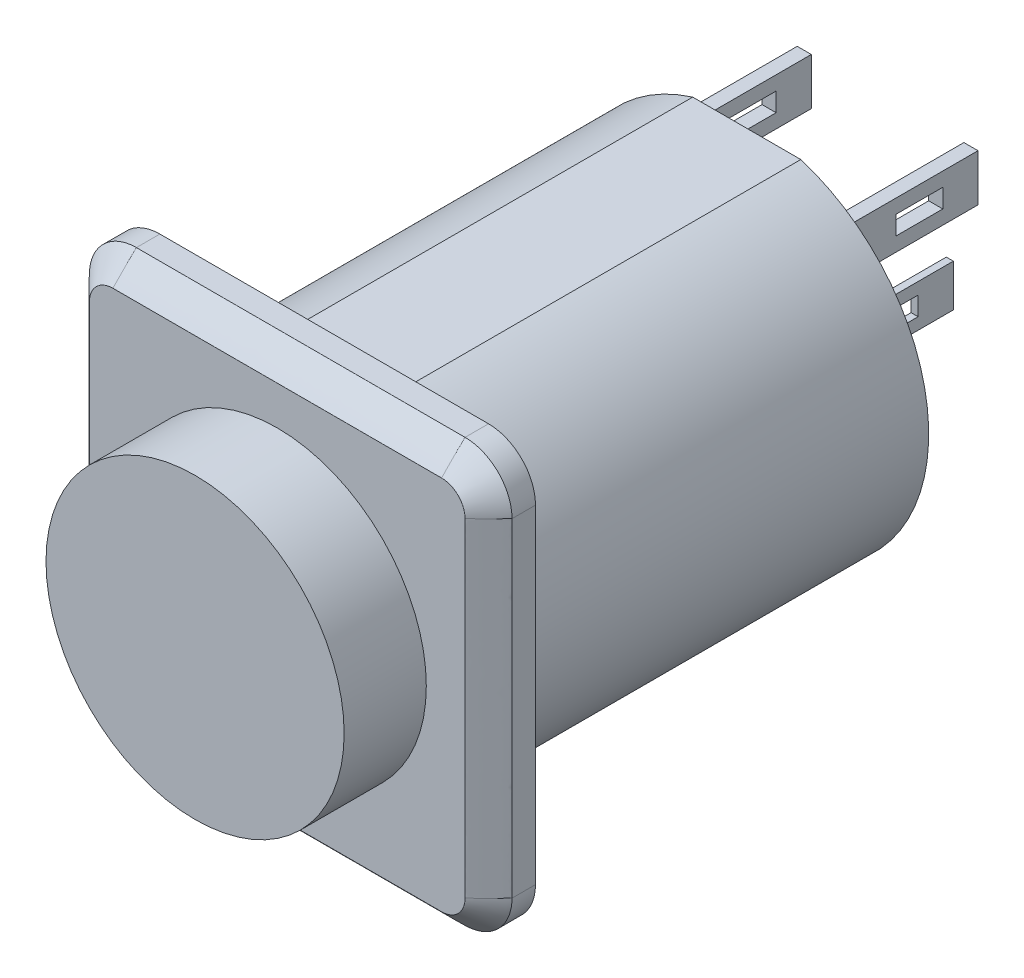
from build123d import *

# Parameters (mm, degrees)
SKETCH1_W             = 18
SKETCH1_H             = 18
BOSS_EXTRUDE1_DEPTH   = 2
FILLET1_R             = 2
FILLET2_SIZE          = 1
SKETCH2_R             = 6.35
BOSS_EXTRUDE2_DEPTH   = 3.5
BOSS_EXTRUDE3_DEPTH   = 18
SKETCH4_W             = 0.6
SKETCH4_H             = 2
BOSS_EXTRUDE4_DEPTH   = 6
SKETCH4_W_2           = 0.3
SKETCH4_H_2           = 1.8
BOSS_EXTRUDE4_2_DEPTH = 6
BOSS_EXTRUDE4_3_DEPTH = 6
BOSS_EXTRUDE4_4_DEPTH = 6
SKETCH5_W             = 2
SKETCH5_H             = 0.8
CUT_EXTRUDE1_DEPTH    = 29.672678709


with BuildPart() as part:
    # Sketch1 → Boss-Extrude1 (new body)
    with BuildSketch(Plane.XY):
        Rectangle(SKETCH1_W, SKETCH1_H)
    extrude(amount=BOSS_EXTRUDE1_DEPTH)

    # Fillet1
    fillet1_edges = [part.edges().sort_by_distance(p)[0] for p in [
        (9, -9, 1),
        (-9, -9, 1),
        (-9, 9, 1),
        (9, 9, 1),
    ]]
    fillet(fillet1_edges, radius=FILLET1_R)

    # Fillet2
    # a fillet whose section is not a circle: 1 mm, written as the material it takes off along each edge
    with BuildSketch(Plane(origin=(-7, 7, 2), x_dir=(0, 1, 0), z_dir=(1, 0, 0))) as fillet2_piece_1:
        with BuildLine():
            Bezier((2, -FILLET2_SIZE), (2, 0), (2 - FILLET2_SIZE, 0), weights=[1, 0.014142136, 1])
            Line((2 - FILLET2_SIZE, 0), (2, 0))
            Line((2, 0), (2, -FILLET2_SIZE))
        make_face()
    revolve(axis=Axis((-7, 7, 2), (0, 0, 1)), revolution_arc=90, mode=Mode.SUBTRACT)
    with BuildSketch(Plane(origin=(-7, 9, 2), x_dir=(0, 0, -1), z_dir=(1, 0, 0))) as fillet2_piece_2:
        with BuildLine():
            Bezier((FILLET2_SIZE, 0), (0, 0), (0, -FILLET2_SIZE), weights=[1, 0.014142136, 1])
            Line((0, -FILLET2_SIZE), (0, 0))
            Line((0, 0), (FILLET2_SIZE, 0))
        make_face()
    extrude(amount=14, mode=Mode.SUBTRACT)
    with BuildSketch(Plane(origin=(7, 7, 2), x_dir=(0, 1, 0), z_dir=(-1, 0, 0))) as fillet2_piece_3:
        with BuildLine():
            Bezier((2, FILLET2_SIZE), (2, 0), (2 - FILLET2_SIZE, 0), weights=[1, 0.014142136, 1])
            Line((2 - FILLET2_SIZE, 0), (2, 0))
            Line((2, 0), (2, FILLET2_SIZE))
        make_face()
    revolve(axis=Axis((7, 7, 2), (0, 0, -1)), revolution_arc=90, mode=Mode.SUBTRACT)
    with BuildSketch(Plane(origin=(9, 7, 2), x_dir=(-1, 0, 0), z_dir=(0, -1, 0)), Plane(origin=(7, -9, 2), x_dir=(0, 1, 0), z_dir=(-1, 0, 0)), Plane(origin=(-9, -7, 2), x_dir=(1, 0, 0), z_dir=(0, 1, 0))) as fillet2_piece_4:
        with BuildLine():
            Bezier((FILLET2_SIZE, 0), (0, 0), (0, FILLET2_SIZE), weights=[1, 0.014142136, 1])
            Line((0, FILLET2_SIZE), (0, 0))
            Line((0, 0), (FILLET2_SIZE, 0))
        make_face()
    extrude(amount=14, mode=Mode.SUBTRACT)
    with BuildSketch(Plane(origin=(7, -7, 2), x_dir=(1, 0, 0), z_dir=(0, 1, 0))) as fillet2_piece_5:
        with BuildLine():
            Bezier((2 - FILLET2_SIZE, 0), (2, 0), (2, FILLET2_SIZE), weights=[1, 0.014142136, 1])
            Line((2, FILLET2_SIZE), (2, 0))
            Line((2, 0), (2 - FILLET2_SIZE, 0))
        make_face()
    revolve(axis=Axis((7, -7, 2), (0, 0, -1)), revolution_arc=90, mode=Mode.SUBTRACT)
    with BuildSketch(Plane(origin=(-7, -7, 2), x_dir=(0, -1, 0), z_dir=(1, 0, 0))) as fillet2_piece_6:
        with BuildLine():
            Bezier((2 - FILLET2_SIZE, 0), (2, 0), (2, FILLET2_SIZE), weights=[1, 0.014142136, 1])
            Line((2, FILLET2_SIZE), (2, 0))
            Line((2, 0), (2 - FILLET2_SIZE, 0))
        make_face()
    revolve(axis=Axis((-7, -7, 2), (0, 0, -1)), revolution_arc=90, mode=Mode.SUBTRACT)

    # Sketch3 → Boss-Extrude3 (add)
    with BuildSketch(Plane(origin=(0, 0, 0), x_dir=(-1, 0, 0), z_dir=(0, 0, -1))):
        with BuildLine():
            ThreePointArc((-2.302715788, 7.4), (-6.241335889, 4.59436898), (-7.75, 0))
            Line((-7.75, 0), (7.75, 0))
            ThreePointArc((7.75, 0), (6.241335889, 4.59436898), (2.302715788, 7.4))
            Line((2.302715788, 7.4), (-2.302715788, 7.4))
        make_face()
        with BuildLine():
            Line((7.75, 0), (-7.75, 0))
            ThreePointArc((-7.75, 0), (-6.241335889, -4.59436898), (-2.302715788, -7.4))
            Line((-2.302715788, -7.4), (2.302715788, -7.4))
            ThreePointArc((2.302715788, -7.4), (6.241335889, -4.59436898), (7.75, 0))
        make_face()
    extrude(amount=BOSS_EXTRUDE3_DEPTH)


with BuildPart() as body_2:
    # Sketch2 → Boss-Extrude2 (new body)
    with BuildSketch(Plane.XY.offset(2)):
        Circle(SKETCH2_R)
    extrude(amount=BOSS_EXTRUDE2_DEPTH)


with BuildPart() as body_3:
    # Sketch4 → Boss-Extrude4 (new body)
    with BuildSketch(Plane(origin=(0, 0, -18), x_dir=(-1, 0, 0), z_dir=(0, 0, -1))):
        with Locations((-3.55, 4.5)):
            Rectangle(SKETCH4_W, SKETCH4_H)
    extrude(amount=BOSS_EXTRUDE4_DEPTH)


with BuildPart() as body_4:
    # Sketch4 → Boss-Extrude4 2 (new body)
    with BuildSketch(Plane(origin=(0, 0, -18), x_dir=(-1, 0, 0), z_dir=(0, 0, -1))):
        with Locations((-2.65, 0)):
            Rectangle(SKETCH4_W_2, SKETCH4_H_2)
    extrude(amount=BOSS_EXTRUDE4_2_DEPTH)


with BuildPart() as body_5:
    # Sketch4 → Boss-Extrude4 3 (new body)
    with BuildSketch(Plane(origin=(0, 0, -18), x_dir=(-1, 0, 0), z_dir=(0, 0, -1))):
        with Locations((2.65, 0)):
            Rectangle(SKETCH4_W_2, SKETCH4_H_2)
    extrude(amount=BOSS_EXTRUDE4_3_DEPTH)


with BuildPart() as body_6:
    # Sketch4 → Boss-Extrude4 4 (new body)
    with BuildSketch(Plane(origin=(0, 0, -18), x_dir=(-1, 0, 0), z_dir=(0, 0, -1))):
        with Locations((3.55, 4.5)):
            Rectangle(SKETCH4_W, SKETCH4_H)
    extrude(amount=BOSS_EXTRUDE4_4_DEPTH)


with BuildPart() as cut_extrude1_tool:
    # Sketch5 → Cut-Extrude1 (new, through all)
    with BuildSketch(Plane(origin=(3.85, 0, 0), x_dir=(0, 0, -1), z_dir=(1, 0, 0))):
        with Locations((21.5, 4.5)):
            Rectangle(SKETCH5_W, SKETCH5_H)
        with Locations((21.5, 0)):
            Rectangle(SKETCH5_W, SKETCH5_H)
    extrude(amount=-CUT_EXTRUDE1_DEPTH)


with BuildPart() as body_3_1:
    add(body_3.part)

    # Cut-Extrude1: cut by cut_extrude1_tool
    add(cut_extrude1_tool.part, mode=Mode.SUBTRACT)


with BuildPart() as body_4_1:
    add(body_4.part)

    # Cut-Extrude1: cut by cut_extrude1_tool
    add(cut_extrude1_tool.part, mode=Mode.SUBTRACT)


with BuildPart() as body_5_1:
    add(body_5.part)

    # Cut-Extrude1: cut by cut_extrude1_tool
    add(cut_extrude1_tool.part, mode=Mode.SUBTRACT)


with BuildPart() as body_6_1:
    add(body_6.part)

    # Cut-Extrude1: cut by cut_extrude1_tool
    add(cut_extrude1_tool.part, mode=Mode.SUBTRACT)


solid = Compound([part.part, body_2.part, body_3_1.part, body_4_1.part, body_5_1.part, body_6_1.part])
